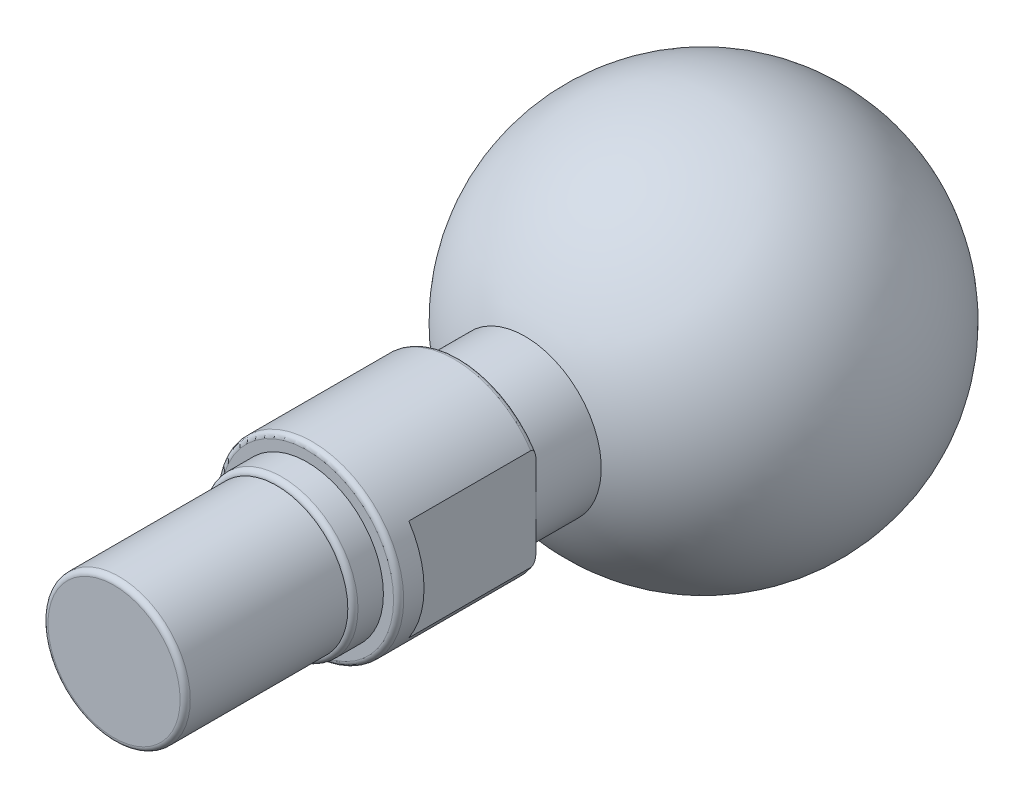
from build123d import *

# Parameters (mm, degrees)
SKETCH_1_R          = 18
EXTRUDE_1_DEPTH     = 116
CUT_EXTRUDE_START   = -38
SKETCH_2_R          = 18
SKETCH_2_R_2        = 15
CUT_EXTRUDE_1_DEPTH = 38
CUT_EXTRUDE_START_2 = -32
SKETCH_3_R          = 15
SKETCH_3_R_2        = 14
CUT_EXTRUDE_2_DEPTH = 32
SKETCH_4_R          = 18
SKETCH_4_R_2        = 15
CUT_EXTRUDE_3_DEPTH = 48
CUT_EXTRUDE_4_DEPTH = 25
FILLET_1_R          = 1
FILLET_2_R          = 1


with BuildPart() as part:
    # 草图1 → 凸台-拉伸1 (new body)
    with BuildSketch(Plane.XY):
        with Locations(Location((0, 0, 0), (0, 0, 180))):
            Circle(SKETCH_1_R)
    extrude(amount=EXTRUDE_1_DEPTH)

    # 草图2 → 切除-拉伸1 (cut)
    with BuildSketch(Plane.XY.offset(116).offset(CUT_EXTRUDE_START)):
        with Locations(Location((0, 0, 0), (0, 0, 180))):
            Circle(SKETCH_2_R)
        Circle(SKETCH_2_R_2, mode=Mode.SUBTRACT)
    extrude(amount=CUT_EXTRUDE_1_DEPTH, mode=Mode.SUBTRACT)

    # 草图3 → 切除-拉伸2 (cut)
    with BuildSketch(Plane.XY.offset(116).offset(CUT_EXTRUDE_START_2)):
        Circle(SKETCH_3_R)
        Circle(SKETCH_3_R_2, mode=Mode.SUBTRACT)
    extrude(amount=CUT_EXTRUDE_2_DEPTH, mode=Mode.SUBTRACT)

    # 草图4 → 切除-拉伸3 (cut)
    with BuildSketch(Plane(origin=(0, 0, 0), x_dir=(-1, 0, 0), z_dir=(0, 0, -1))):
        Circle(SKETCH_4_R)
        with Locations(Location((0, 0, 0), (0, 0, 180))):
            Circle(SKETCH_4_R_2, mode=Mode.SUBTRACT)
    extrude(amount=-CUT_EXTRUDE_3_DEPTH, mode=Mode.SUBTRACT)

    # 草图5 → 旋转2 (revolve)
    with BuildSketch(Plane(origin=(0, 0, 0), x_dir=(-1, 0, 0), z_dir=(0, 0, -1))):
        with BuildLine():
            Line((0, 28), (0, -28))
            Line((0, -28), (0, -38.2))
            ThreePointArc((0, -38.2), (38.2, 0), (0, 38.2))
            Line((0, 38.2), (0, 28))
        make_face()
    revolve(axis=Axis((0, 28, 0), (0, -1, 0)))

    # 草图6 → 切除-拉伸4 (cut)
    with BuildSketch(Plane(origin=(0, 0, 48), x_dir=(-1, 0, 0), z_dir=(0, 0, -1))):
        Polygon((15, 0), (15, 35.868856724), (38.265827157, 35.868856724), (38.265827157, -37.868854143), (15, -37.868854143), align=None)
        Polygon((-15, -37.868854143), (-15, 0), (-15, 35.868856724), (-38.265827157, 35.868856724), (-38.265827157, -37.868854143), align=None)
    extrude(amount=-CUT_EXTRUDE_4_DEPTH, mode=Mode.SUBTRACT)

    # 圆角1
    fillet_1_edges = [part.edges().sort_by_distance(p)[0] for p in [
        (-15, 0, 84),
        (-14, 0, 116),
        (0, 18, 48),
        (18, 0, 78),
    ]]
    fillet(fillet_1_edges, radius=FILLET_1_R - 0.0001)  # a hair under: the kernel refuses the full size

    # 圆角2
    fillet_2_edges = [part.edges().sort_by_distance(p)[0] for p in [
        (0, -18, 48),
    ]]
    fillet(fillet_2_edges, radius=FILLET_2_R)


solid = part.part
